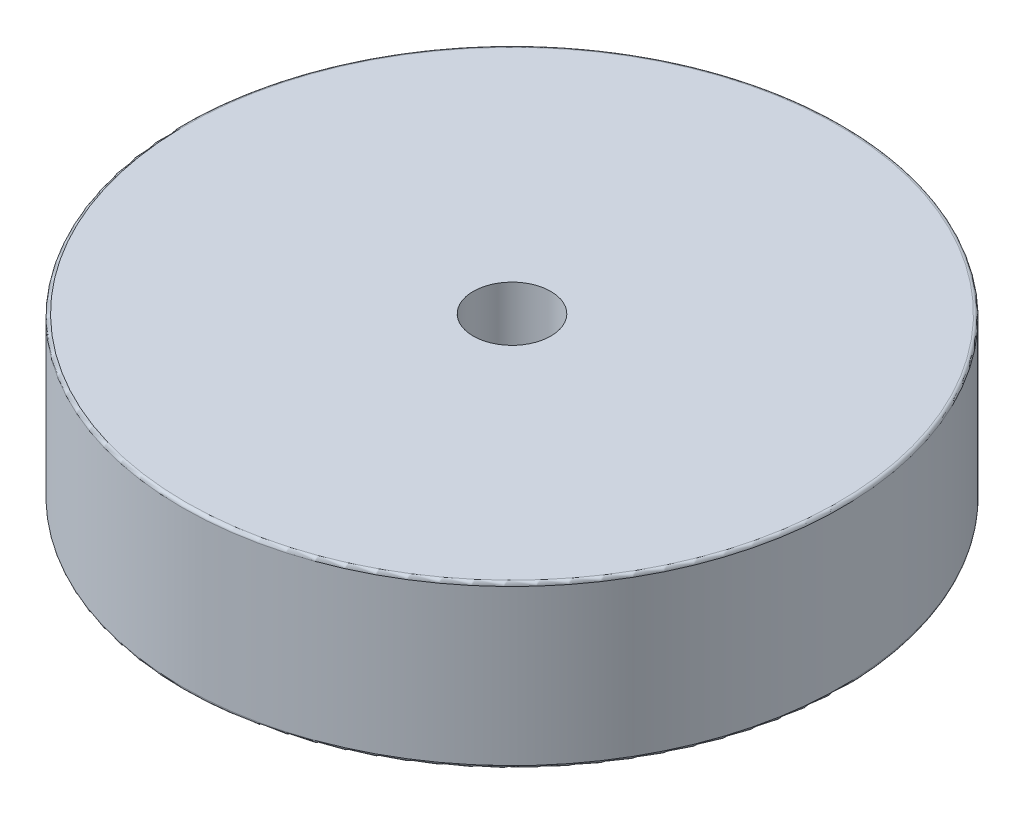
from build123d import *

# Parameters (mm, degrees)
SKETCH2_R           = 64.77
BOSS_EXTRUDE1_DEPTH = 31.75
FILLET1_R           = 0.635
SKETCH3_R           = 7.62
CUT_EXTRUDE1_DEPTH  = 13.97


with BuildPart() as part:
    # Sketch2 → Boss-Extrude1 (new body)
    with BuildSketch(Plane(origin=(0, 0, 0), x_dir=(1, 0, 0), z_dir=(0, 1, 0))):
        Circle(SKETCH2_R)
    extrude(amount=BOSS_EXTRUDE1_DEPTH)

    # Fillet1
    fillet1_edges = [part.edges().sort_by_distance(p)[0] for p in [
        (-64.77, 0, 0),
        (-64.77, 31.75, 0),
    ]]
    fillet(fillet1_edges, radius=FILLET1_R)

    # Sketch3 → Cut-Extrude1 (cut)
    with BuildSketch(Plane(origin=(0, 31.75, 0), x_dir=(1, 0, 0), z_dir=(0, 1, 0))):
        Circle(SKETCH3_R)
    extrude(amount=-CUT_EXTRUDE1_DEPTH, mode=Mode.SUBTRACT)


solid = part.part
